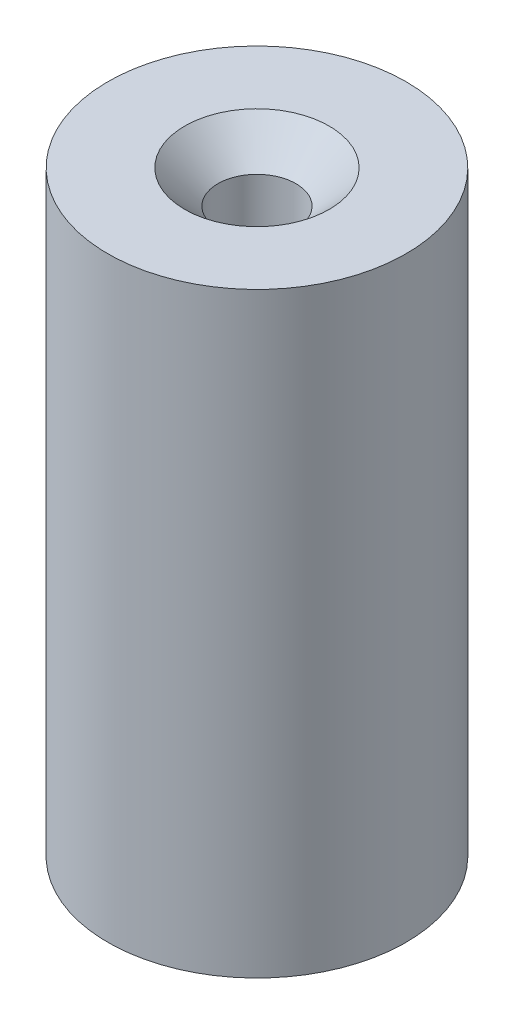
from build123d import *

# Parameters (mm, degrees)
SKETCH_1_R                  = 6.5
EXTRUDE_1_DEPTH             = 26
SKETCH_2_R                  = 2.85
CUT_EXTRUDE_1_DEPTH         = 3.5
HOLE_WIZARD_M32_D           = 3.4
HOLE_WIZARD_M32_CSINK_D     = 6.3
HOLE_WIZARD_M32_CSINK_ANGLE = 90


with BuildPart() as part:
    # Эскиз1 → Бобышка-Вытянуть1 (new body)
    with BuildSketch(Plane(origin=(0, 0, 0), x_dir=(1, 0, 0), z_dir=(0, 1, 0))):
        Circle(SKETCH_1_R)
    extrude(amount=EXTRUDE_1_DEPTH)

    # Эскиз2 → Вырез-Вытянуть1 (cut)
    with BuildSketch(Plane.XZ):
        Circle(SKETCH_2_R)
    extrude(amount=-CUT_EXTRUDE_1_DEPTH, mode=Mode.SUBTRACT)

    # Зенковка для  винта с плоской головкой M32 (through all)
    with Locations(Plane(origin=(0, 26, 0), x_dir=(1, 0, 0), z_dir=(0, 1, 0))):
        with Locations((0, 0)):
            CounterSinkHole(HOLE_WIZARD_M32_D / 2, HOLE_WIZARD_M32_CSINK_D / 2, counter_sink_angle=HOLE_WIZARD_M32_CSINK_ANGLE)


solid = part.part
